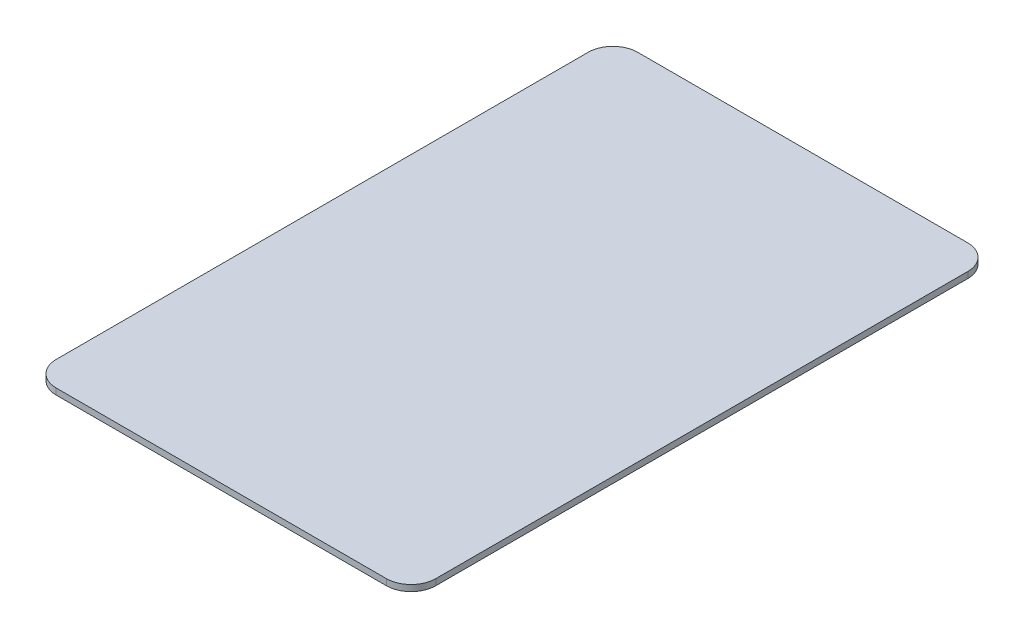
from build123d import *

# Parameters (mm, degrees)
SKETCH1_W          = 97.42424
SKETCH1_H          = 149.225
BASE_FLANGE1_DEPTH = 1.5875
FILLET1_R          = 6.35


# Sheet-metal steps are written as plain solids
with BuildPart() as part:
    # Sketch1 → Base-Flange1 (new body)
    with BuildSketch(Plane(origin=(0, 0, 0), x_dir=(1, 0, 0), z_dir=(0, 1, 0))):
        with Locations((48.71212, 74.6125)):
            Rectangle(SKETCH1_W, SKETCH1_H)
    extrude(amount=-BASE_FLANGE1_DEPTH)

    # Fillet1
    fillet1_edges = [part.edges().sort_by_distance(p)[0] for p in [
        (0, -0.79375, -149.225),
        (97.42424, -0.79375, -149.225),
        (97.42424, -0.79375, 0),
        (0, -0.79375, 0),
    ]]
    fillet(fillet1_edges, radius=FILLET1_R)


solid = part.part
